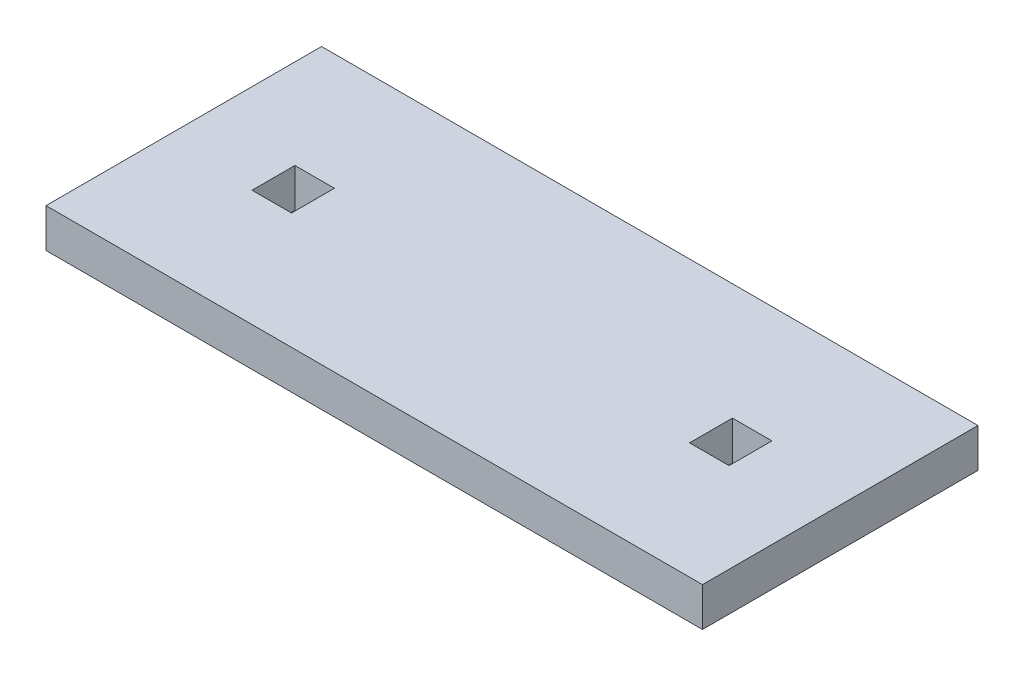
from build123d import *

# Parameters (mm, degrees)
SKETCH1_W           = 214.4
SKETCH1_H           = 90
SKETCH1_W_2         = 12.9
SKETCH1_H_2         = 14
BOSS_EXTRUDE1_DEPTH = 12.7


with BuildPart() as part:
    # Sketch1 → Boss-Extrude1 (new body)
    with BuildSketch(Plane(origin=(0, 0, 0), x_dir=(1, 0, 0), z_dir=(0, 1, 0))):
        with Locations((107.2, 45)):
            Rectangle(SKETCH1_W, SKETCH1_H)
        with Locations((35.75, 45)):
            Rectangle(SKETCH1_W_2, SKETCH1_H_2, mode=Mode.SUBTRACT)
        with Locations((178.65, 45)):
            Rectangle(SKETCH1_W_2, SKETCH1_H_2, mode=Mode.SUBTRACT)
    extrude(amount=BOSS_EXTRUDE1_DEPTH)


solid = part.part
